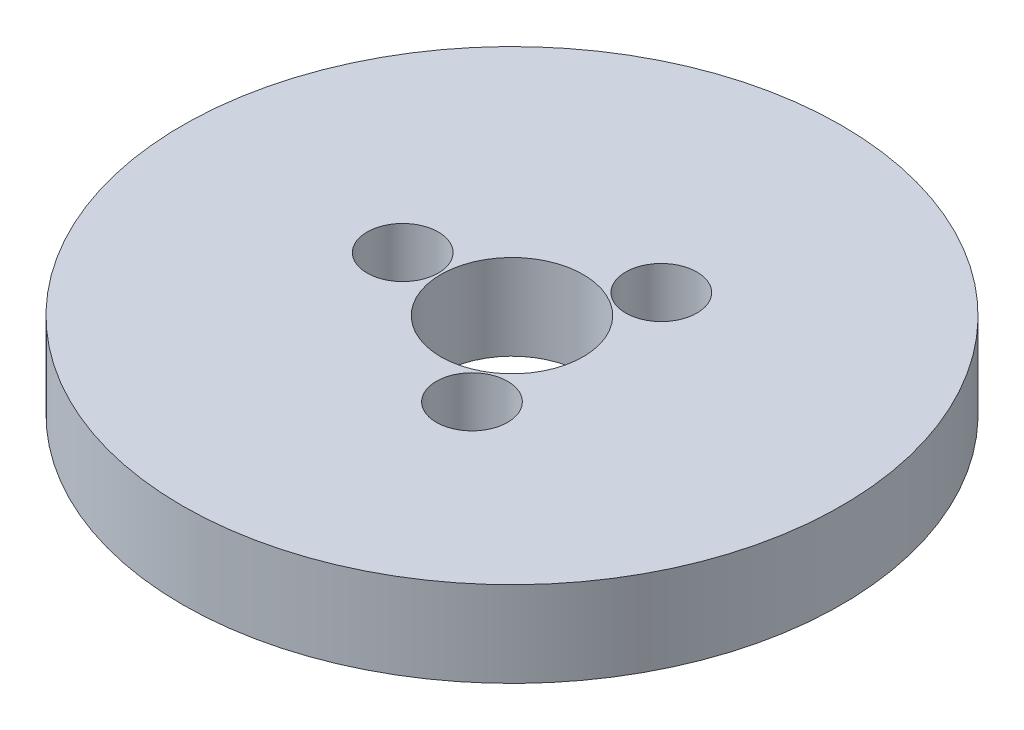
from build123d import *

# Parameters (mm, degrees)
SKETCH1_R           = 92.5
BOSS_EXTRUDE1_DEPTH = 24
SKETCH2_R           = 20
CUT_EXTRUDE1_DEPTH  = 133.998120287
SKETCH3_R           = 10
CUT_EXTRUDE2_DEPTH  = 20.141919541
CIRPATTERN1_COUNT   = 3


with BuildPart() as part:
    # Sketch1 → Boss-Extrude1 (new body)
    with BuildSketch(Plane(origin=(0, 0, 0), x_dir=(1, 0, 0), z_dir=(0, 1, 0))):
        Circle(SKETCH1_R)
    extrude(amount=BOSS_EXTRUDE1_DEPTH)

    # Sketch2 → Cut-Extrude1 (cut, through all)
    with BuildSketch(Plane(origin=(0, 0, 0), x_dir=(1, 0, 0), z_dir=(0, 1, 0))):
        Circle(SKETCH2_R)
    extrude(amount=CUT_EXTRUDE1_DEPTH, mode=Mode.SUBTRACT)

    # Sketch3 → Cut-Extrude2 (cut)
    with BuildSketch(Plane(origin=(0, 24, 0), x_dir=(1, 0, 0), z_dir=(0, 1, 0))):
        with Locations((-30.676292685, 0)):
            Circle(SKETCH3_R)
    cut_extrude2 = extrude(amount=-CUT_EXTRUDE2_DEPTH, mode=Mode.SUBTRACT)

    # CirPattern1: Cut-Extrude2 ×3 about axis
    cirpattern1_axis = Axis((0, 0, 0), (0, 1, 0))
    for i in range(1, CIRPATTERN1_COUNT):
        add(cut_extrude2.rotate(cirpattern1_axis, i * 360 / CIRPATTERN1_COUNT), mode=Mode.SUBTRACT)


solid = part.part
